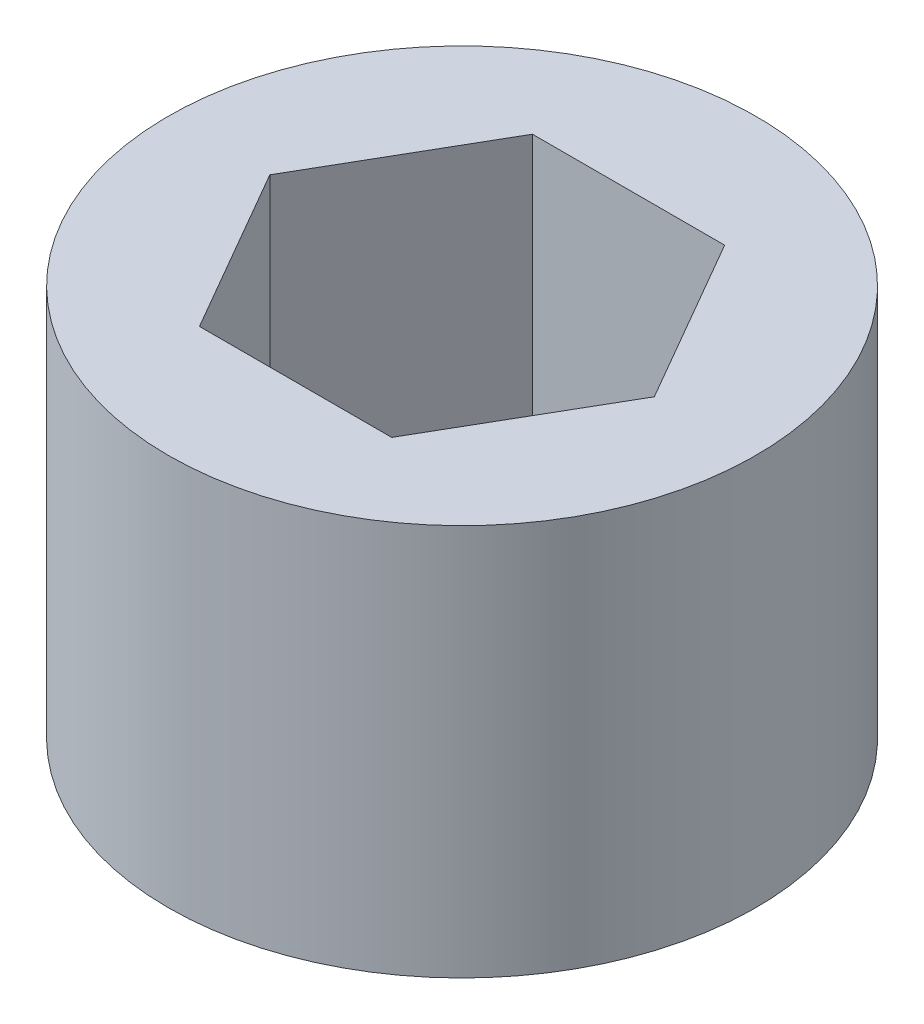
from build123d import *

# Parameters (mm, degrees)
SKETCH1_R           = 7.5
BOSS_EXTRUDE1_DEPTH = 10


with BuildPart() as part:
    # Sketch1 → Boss-Extrude1 (new body)
    with BuildSketch(Plane(origin=(0, 0, 0), x_dir=(1, 0, 0), z_dir=(0, 1, 0))):
        Circle(SKETCH1_R)
        Polygon((4.907477288, 0), (2.453738644, 4.25), (-2.453738644, 4.25), (-4.907477288, 0), (-2.453738644, -4.25), (2.453738644, -4.25), align=None, mode=Mode.SUBTRACT)
    extrude(amount=BOSS_EXTRUDE1_DEPTH)


solid = part.part
